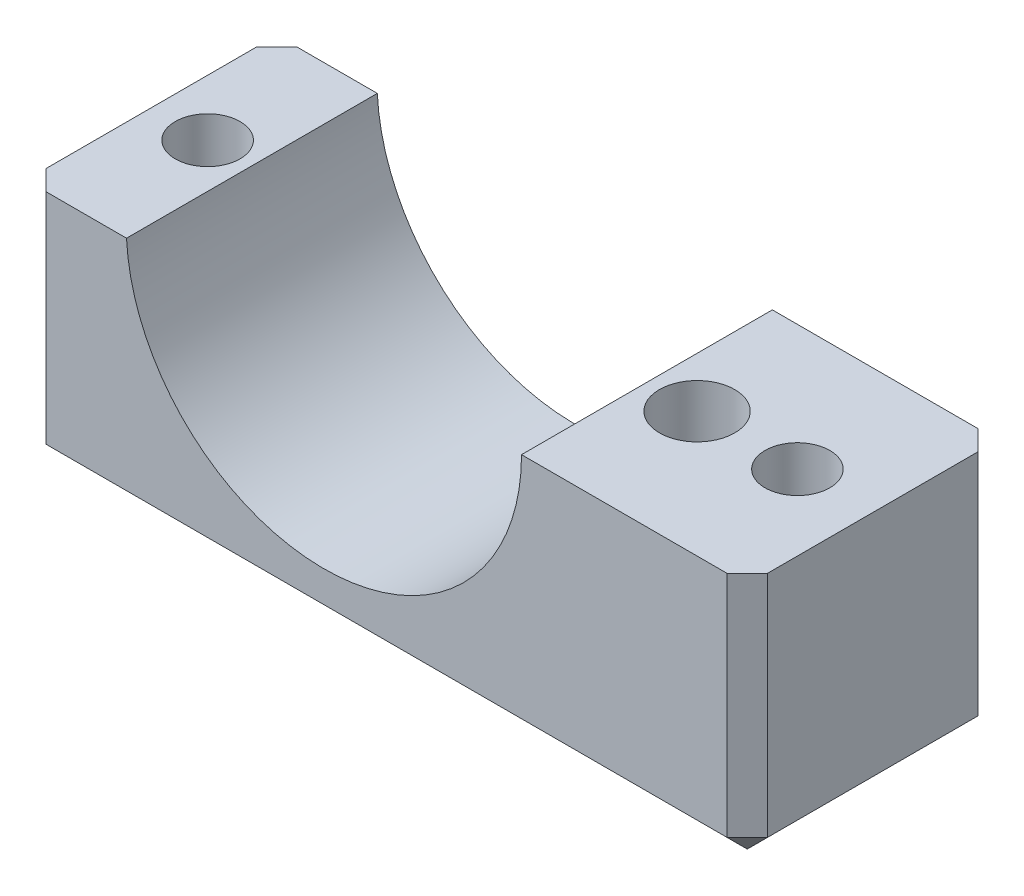
from build123d import *

# Parameters (mm, degrees)
BOSS_EXTRUDE1_DEPTH                               = 31.75
CBORE_FOR_5_16_SOCKET_HEAD_CAP_SCREW1_D           = 8.2042
CBORE_FOR_5_16_SOCKET_HEAD_CAP_SCREW1_CBORE_D     = 12.7
CBORE_FOR_5_16_SOCKET_HEAD_CAP_SCREW1_CBORE_DEPTH = 9.525
F_3_8_0_375_CLEARANCE_DOWEL_HOLE2_D               = 9.525
SKETCH9_W                                         = 23.721553131
SKETCH9_H                                         = 31.75
CUT_EXTRUDE1_DEPTH                                = 1.27


with BuildPart() as part:
    # Sketch1 → Boss-Extrude1 (new body)
    with BuildSketch(Plane.XY):
        with BuildLine():
            Line((0, 0), (12.7, 0))
            ThreePointArc((12.7, 0), (37.719, -25.019), (62.738, 0))
            Line((62.738, 0), (91.313, 0))
            Line((91.313, 0), (91.313, -31.496))
            Line((91.313, -31.496), (0, -31.496))
            Line((0, -31.496), (0, 0))
        make_face()
    extrude(amount=BOSS_EXTRUDE1_DEPTH)

    # CBORE for 5/16 Socket Head Cap Screw1 (through all)
    with Locations(Plane(origin=(0, -31.496, 0), x_dir=(-1, 0, 0), z_dir=(0, -1, 0))):
        with Locations((-7.1247, -15.875), (-81.788, -15.875)):
            CounterBoreHole(CBORE_FOR_5_16_SOCKET_HEAD_CAP_SCREW1_D / 2, CBORE_FOR_5_16_SOCKET_HEAD_CAP_SCREW1_CBORE_D / 2, CBORE_FOR_5_16_SOCKET_HEAD_CAP_SCREW1_CBORE_DEPTH)

    # 3/8 (0.375) Clearance Dowel Hole2 (through all)
    with Locations(Plane(origin=(0, -31.496, 0), x_dir=(-1, 0, 0), z_dir=(0, -1, 0))):
        with Locations((-69.088, -15.875)):
            Hole(F_3_8_0_375_CLEARANCE_DOWEL_HOLE2_D / 2)

    # Sketch9 → Cut-Extrude1 (cut)
    with BuildSketch(Plane(origin=(0, 0, 0), x_dir=(1, 0, 0), z_dir=(0, 1, 0))):
        with Locations((11.860776566, -15.875)):
            Rectangle(SKETCH9_W, SKETCH9_H)
    extrude(amount=-CUT_EXTRUDE1_DEPTH, mode=Mode.SUBTRACT)

    # Chamfer1
    # the kernel refuses this chamfer: 2.54 mm, written as the material it takes off along each edge
    with BuildSketch(Plane(origin=(89.619666667, -29.802666667, 30.056666667), x_dir=(0, -0.7071067811865476, -0.7071067811865476), z_dir=(0.5773502691896247, -0.5773502691896263, 0.5773502691896263)), Plane(origin=(1.693333333, -29.802666667, 1.693333333), x_dir=(0.7071067811865474, 0, -0.7071067811865477), z_dir=(-0.5773502691896264, -0.5773502691896247, -0.5773502691896262))) as chamfer1_piece_1:
        Polygon((-1.796051224, -1.036950658), (1.796051224, -1.036950658), (0, 2.073901316), align=None)
    extrude(amount=3.226233304, mode=Mode.SUBTRACT)
    with BuildSketch(Plane(origin=(89.619666667, -29.802666667, 1.693333333), x_dir=(0, -0.7071067811865474, 0.7071067811865477), z_dir=(0.5773502691896246, -0.5773502691896264, -0.5773502691896262)), Plane(origin=(1.693333333, -29.802666667, 30.056666667), x_dir=(0.7071067811865476, 0, 0.7071067811865476), z_dir=(-0.5773502691896263, -0.5773502691896247, 0.5773502691896263))) as chamfer1_piece_2:
        Polygon((-1.796051224, 1.036950658), (1.796051224, 1.036950658), (0, -2.073901316), align=None)
    extrude(amount=3.226233304, mode=Mode.SUBTRACT)
    with BuildSketch(Plane(origin=(91.313, 6.532074789, 31.75), x_dir=(-0.9996219169112968, 0, 0.02749587661058591), z_dir=(0, -1, 0))) as chamfer1_piece_3:
        with BuildLine():
            Line((2.612829916, 0), (-0.143629773, 2.608879196))
            Line((-0.143629773, 2.608879196), (-0.194410567, 2.607482405))
            ThreePointArc((-0.194410567, 2.607482405), (-0.086688237, 1.304030487), (-0.050780793, -0.001396791))
            Line((-0.050780793, -0.001396791), (0.001396791, -0.050780793))
            ThreePointArc((0.001396791, -0.050780793), (1.306824068, -0.01487335), (2.614226706, -0.050780793))
            Line((2.614226706, -0.050780793), (2.612829916, 0))
        make_face()
    extrude(amount=44.560149579, mode=Mode.SUBTRACT)
    with BuildSketch(Plane(origin=(91.313, -31.496, -6.532074789), x_dir=(-0.9996219169112968, -0.02749587661058591, 0), z_dir=(0, 0, 1)), Plane(origin=(0, -31.496, -6.532074789), x_dir=(-0.027495876610586358, 0.9996219169112968, 0), z_dir=(0, 0, 1))) as chamfer1_piece_4:
        with BuildLine():
            Line((2.612829916, 0), (-0.143629773, -2.608879196))
            Line((-0.143629773, -2.608879196), (-0.194410567, -2.607482405))
            ThreePointArc((-0.194410567, -2.607482405), (-0.086688237, -1.304030487), (-0.050780793, 0.001396791))
            Line((-0.050780793, 0.001396791), (0.001396791, 0.050780793))
            ThreePointArc((0.001396791, 0.050780793), (1.306824068, 0.01487335), (2.614226706, 0.050780793))
            Line((2.614226706, 0.050780793), (2.612829916, 0))
        make_face()
    extrude(amount=44.814149579, mode=Mode.SUBTRACT)
    with BuildSketch(Plane(origin=(0, -38.028074789, 0), x_dir=(-0.027495876610586365, 0, 0.9996219169112968), z_dir=(0, 1, 0))) as chamfer1_piece_5:
        with BuildLine():
            Line((2.612829916, 0), (-0.143629773, 2.608879196))
            Line((-0.143629773, 2.608879196), (-0.194410567, 2.607482405))
            ThreePointArc((-0.194410567, 2.607482405), (-0.086688237, 1.304030487), (-0.050780793, -0.001396791))
            Line((-0.050780793, -0.001396791), (0.001396791, -0.050780793))
            ThreePointArc((0.001396791, -0.050780793), (1.306824068, -0.01487335), (2.614226706, -0.050780793))
            Line((2.614226706, -0.050780793), (2.612829916, 0))
        make_face()
    extrude(amount=43.290149579, mode=Mode.SUBTRACT)
    with BuildSketch(Plane(origin=(0, -38.028074789, 31.75), x_dir=(-0.0274958766105864, 0, -0.9996219169112968), z_dir=(0, 1, 0))) as chamfer1_piece_6:
        with BuildLine():
            Line((2.612829916, 0), (-0.143629773, -2.608879196))
            Line((-0.143629773, -2.608879196), (-0.194410567, -2.607482405))
            ThreePointArc((-0.194410567, -2.607482405), (-0.086688237, -1.304030487), (-0.050780793, 0.001396791))
            Line((-0.050780793, 0.001396791), (0.001396791, 0.050780793))
            ThreePointArc((0.001396791, 0.050780793), (1.306824068, 0.01487335), (2.614226706, 0.050780793))
            Line((2.614226706, 0.050780793), (2.612829916, 0))
        make_face()
    extrude(amount=43.290149579, mode=Mode.SUBTRACT)
    with BuildSketch(Plane(origin=(97.845074789, -31.496, 31.75), x_dir=(0, 0.9996219169112966, 0.027495876610585942), z_dir=(-1, 0, 0))) as chamfer1_piece_7:
        with BuildLine():
            Line((2.612829916, 0), (-0.143629773, 2.608879196))
            Line((-0.143629773, 2.608879196), (-0.194410567, 2.607482405))
            ThreePointArc((-0.194410567, 2.607482405), (-0.086688237, 1.304030487), (-0.050780793, -0.001396791))
            Line((-0.050780793, -0.001396791), (0.001396791, -0.050780793))
            ThreePointArc((0.001396791, -0.050780793), (1.306824068, -0.01487335), (2.614226706, -0.050780793))
            Line((2.614226706, -0.050780793), (2.612829916, 0))
        make_face()
    extrude(amount=104.377149579, mode=Mode.SUBTRACT)
    with BuildSketch(Plane(origin=(91.313, 6.532074789, 0), x_dir=(-0.9996219169112968, 0, -0.027495876610586324), z_dir=(0, -1, 0))) as chamfer1_piece_8:
        with BuildLine():
            Line((2.612829916, 0), (-0.143629773, -2.608879196))
            Line((-0.143629773, -2.608879196), (-0.194410567, -2.607482405))
            ThreePointArc((-0.194410567, -2.607482405), (-0.086688237, -1.304030487), (-0.050780793, 0.001396791))
            Line((-0.050780793, 0.001396791), (0.001396791, 0.050780793))
            ThreePointArc((0.001396791, 0.050780793), (1.306824068, 0.01487335), (2.614226706, 0.050780793))
            Line((2.614226706, 0.050780793), (2.612829916, 0))
        make_face()
    extrude(amount=44.560149579, mode=Mode.SUBTRACT)
    with BuildSketch(Plane(origin=(97.845074789, -31.496, 0), x_dir=(0, 0.9996219169112966, -0.0274958766105864), z_dir=(-1, 0, 0))) as chamfer1_piece_9:
        with BuildLine():
            Line((2.612829916, 0), (-0.143629773, -2.608879196))
            Line((-0.143629773, -2.608879196), (-0.194410567, -2.607482405))
            ThreePointArc((-0.194410567, -2.607482405), (-0.086688237, -1.304030487), (-0.050780793, 0.001396791))
            Line((-0.050780793, 0.001396791), (0.001396791, 0.050780793))
            ThreePointArc((0.001396791, 0.050780793), (1.306824068, 0.01487335), (2.614226706, 0.050780793))
            Line((2.614226706, 0.050780793), (2.612829916, 0))
        make_face()
    extrude(amount=104.377149579, mode=Mode.SUBTRACT)


solid = part.part
